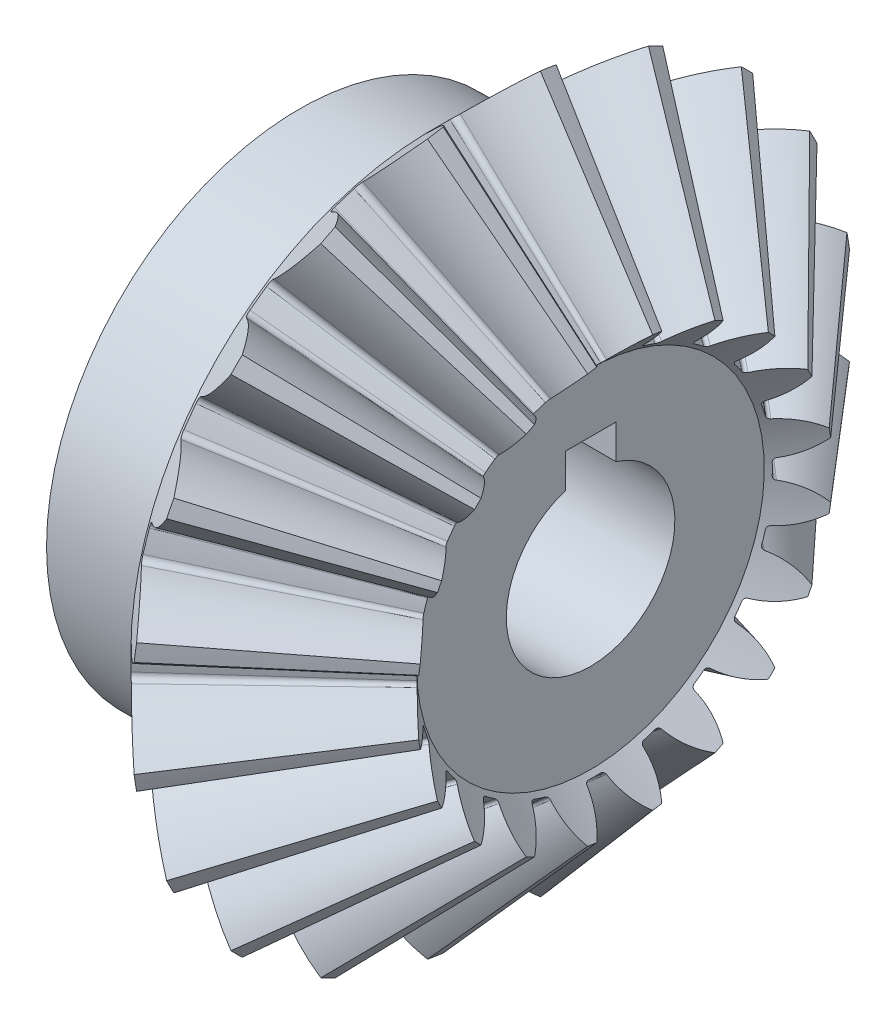
from build123d import *

# Parameters (mm, degrees)
TEETHCUTS_COUNT = 20
TEETHCUTS_ANGLE = 342
HUBSKE_R        = 15
HUB_DEPTH       = 7.901955376
BORSKE_R        = 5
BORE_DEPTH      = 30.0028956
KEYSKE_W        = 3
KEYSKE_H        = 6.8
KEYWAY_DEPTH    = 30.0028956
THREAD4_PITCH   = 0.3


with BuildPart() as part:
    # BasProSke → Base-Revolve (revolve)
    with BuildSketch(Plane(origin=(0, 0, 0), x_dir=(1, 0, 0), z_dir=(0, 1, 0)), mode=Mode.PRIVATE) as base_revolve_sk:
        Polygon((0, 0), (0, 17.899008978), (3.515204589, 21.414213561), (11.400485955, 12.328932179), (9.376656368, 10.305102596), (9.376656368, 0), align=None)
    revolve(base_revolve_sk.sketch.rotate(Axis((-10, 0, 0), (1, 0, 0)), 180), axis=Axis((-10, 0, 0), (1, 0, 0)))

    # ToothCut: read off the stored shape, not the designer's step
    # ToothCut: loft between two sections, ruled curve by curve
    toothcut_from = [
        Edge.make_bspline([(22.107036673, 0.006045648, -0.009390945), (22.102810287, 0.001819262, -0.014832638), (22.097123249, -0.003867777, -0.014025248), (22.093746048, -0.007244978, -0.007504073)], [0, 0, 0, 0, 1, 1, 1, 1], 3, [1, 0.779000961, 0.779000961, 1]),
        Edge.make_bspline([(22.093746048, -0.007244978, 0.007504073), (22.097123249, -0.003867777, 0.014025248), (22.102810287, 0.001819262, 0.014832638), (22.107036673, 0.006045648, 0.009390945)], [0, 0, 0, 0, 1, 1, 1, 1], 3, [1, 0.779000961, 0.779000961, 1]),
        Edge.make_bspline([(22.093746048, -0.007244978, -0.007504073), (22.093246357, -0.007744669, -0.006539199), (22.09284735, -0.008143676, -0.005484709), (22.092556922, -0.008434103, -0.004361469)], [0, 0, 0, 0, 1, 1, 1, 1], 3, [1, 0.993403623, 0.993403623, 1]),
        Edge.make_bspline([(22.092556922, -0.008434103, 0.004361469), (22.09284735, -0.008143676, 0.005484709), (22.093246357, -0.007744669, 0.006539199), (22.093746048, -0.007244978, 0.007504073)], [0, 0, 0, 0, 1, 1, 1, 1], 3, [1, 0.993403623, 0.993403623, 1]),
        Edge.make_bspline([(22.092556922, -0.008434103, -0.004361469), (22.091821001, -0.009170025, -0.001515261), (22.091821001, -0.009170025, 0.001515261), (22.092556922, -0.008434103, 0.004361469)], [0, 0, 0, 0, 1, 1, 1, 1], 3, [1, 0.959453942, 0.959453942, 1]),
        Edge.make_line((22.107036673, 0.006045648, 0.009390945), (22.107036673, 0.006045648, -0.009390945)),
    ]
    toothcut_to = [
        Edge.make_bspline([(3.663019018, 21.56202799, -3.211244356), (2.831810312, 20.730819285, -2.040553938), (1.789743173, 19.688752148, -1.278632658), (0.63374798, 18.532756957, -0.996352455)], [0, 0, 0, 0, 1, 1, 1, 1], 3, [1, 0.968994199, 0.968994199, 1]),
        Edge.make_bspline([(0.63374798, 18.532756957, 0.996352455), (1.789743173, 19.688752148, 1.278632658), (2.831810312, 20.730819285, 2.040553938), (3.663019018, 21.56202799, 3.211244356)], [0, 0, 0, 0, 1, 1, 1, 1], 3, [1, 0.968994199, 0.968994199, 1]),
        Edge.make_bspline([(0.63374798, 18.532756957, -0.996352455), (0.496005207, 18.395014184, -0.962717317), (0.407835311, 18.306844288, -0.80932369), (0.412687652, 18.311696629, -0.611762623)], [0, 0, 0, 0, 1, 1, 1, 1], 3, [1, 0.835736227, 0.835736227, 1]),
        Edge.make_bspline([(0.412687652, 18.311696629, 0.611762623), (0.407835311, 18.306844288, 0.80932369), (0.496005207, 18.395014184, 0.962717317), (0.63374798, 18.532756957, 0.996352455)], [0, 0, 0, 0, 1, 1, 1, 1], 3, [1, 0.835736227, 0.835736227, 1]),
        Edge.make_bspline([(0.412687652, 18.311696629, -0.611762623), (0.422702729, 18.321711707, -0.204002844), (0.422702729, 18.321711707, 0.204002844), (0.412687652, 18.311696629, 0.611762623)], [0, 0, 0, 0, 1, 1, 1, 1], 3, [1, 0.999598195, 0.999598195, 1]),
        Edge.make_line((3.663019018, 21.56202799, 3.211244356), (3.663019018, 21.56202799, -3.211244356)),
    ]
    toothcut = Solid(Shell([*[Face.make_surface_from_curves(toothcut_from[k], toothcut_to[k]) for k in range(6)], Face(Wire(toothcut_from)), Face(Wire(toothcut_to))]))
    add(toothcut, mode=Mode.SUBTRACT)

    # TeethCuts: ToothCut ×20 about axis
    teethcuts_axis = Axis((-10, 0, 0), (1, 0, 0))
    for i in range(1, TEETHCUTS_COUNT):
        add(toothcut.rotate(teethcuts_axis, i * TEETHCUTS_ANGLE / (TEETHCUTS_COUNT - 1)), mode=Mode.SUBTRACT)

    # HubSke → Hub (add)
    with BuildSketch(Plane.ZY):
        with Locations(Location((0, 0, 0), (0, 0, 180))):
            Circle(HUBSKE_R)
    extrude(amount=HUB_DEPTH)

    # BorSke → Bore (cut, symmetric)
    with BuildSketch(Plane(origin=(0, 0, 0), x_dir=(0, 0, -1), z_dir=(1, 0, 0))):
        with Locations(Location((0, 0, 0), (0, 0, 180))):
            Circle(BORSKE_R)
    extrude(amount=BORE_DEPTH, both=True, mode=Mode.SUBTRACT)

    # KeySke → Keyway (cut, symmetric)
    with BuildSketch(Plane(origin=(0, 0, 0), x_dir=(0, 0, -1), z_dir=(1, 0, 0))):
        with Locations((0, 3.4)):
            Rectangle(KEYSKE_W, KEYSKE_H)
    extrude(amount=KEYWAY_DEPTH, both=True, mode=Mode.SUBTRACT)

    # Sketch1 → CBORE for M2.5 SHCS1 (revolve, cut)
    with BuildSketch(Plane(origin=(-3.937080358, -11.535008497, -9.588721447), x_dir=(0, 0.6392480964452122, -0.769000566443987), z_dir=(1, 0, 0))):
        Polygon((0, 0), (0, 15.871247898), (1.45, 15), (1.45, 2.5), (2.75, 2.5), (2.75, 0.025), (2.775, 0), align=None)
    revolve(axis=Axis((-3.937080358, -16.418162094, -13.647946859), (0, 0.769000566443987, 0.6392480964452122)), mode=Mode.SUBTRACT)

    # Thread4: arcs per turn and ends read off the stored shape
    # Thread4: the profile of Thread Profile3 profile screwed along a right-hand helix through 50 turns, 6 arcs to a turn; built about Z, then put on its axis
    thread4_z = Axis((0, 0, 0), (0, 0, 1))
    thread4_corners = [(1.4497, 0, -0.000173204), (1.612379762, 0, 0.09375), (1.612379762, 0, 0.13125), (1.4497, 0, 0.225173205)]
    with BuildLine(mode=Mode.PRIVATE) as thread4_profile:
        Line(thread4_corners[0], thread4_corners[1])
        Line(thread4_corners[1], thread4_corners[2])
        Line(thread4_corners[2], thread4_corners[3])
        Line(thread4_corners[3], thread4_corners[0])
    thread4_cap = Face(thread4_profile.wire())
    thread4_turn_angles = [0, 30, 60, 90, 120, 150, 180, 210, 240, 270, 300, 330, 360]
    thread4_turn_weights = [1, 0.8660254037844387, 1, 0.8660254037844387, 1, 0.8660254037844387, 1, 0.8660254037844387, 1, 0.8660254037844387, 1, 0.8660254037844387, 1]
    thread4_turn_rails = [Edge.make_bspline([Vector(p[0], p[1], 0).rotate(thread4_z, thread4_turn_angles[k]) / thread4_turn_weights[k] + Vector(0, 0, p[2] + THREAD4_PITCH * thread4_turn_angles[k] / 360) for k in range(13)], [0, 0, 0, 1, 1, 2, 2, 3, 3, 4, 4, 5, 5, 6, 6, 6], 2, thread4_turn_weights) for p in thread4_corners]
    thread4_turn_sides = [Face.make_surface_from_curves(thread4_turn_rails[p[0]], thread4_turn_rails[p[1]]) for p in [(0, 1), (1, 2), (2, 3), (3, 0)]]
    thread4 = Plane(origin=(-3.937080358, -9.612507081, -7.990601206), x_dir=(1, 0, 0), z_dir=(0, 0.769000566, 0.639248096)) * Solid(Shell([*[p.moved(Location((0, 0, THREAD4_PITCH * i))) for i in range(50) for p in thread4_turn_sides], thread4_cap, thread4_cap.rotate(thread4_z, 18000).moved(Location((0, 0, THREAD4_PITCH * 18000 / 360)))]))
    add(thread4, mode=Mode.SUBTRACT)


solid = part.part
